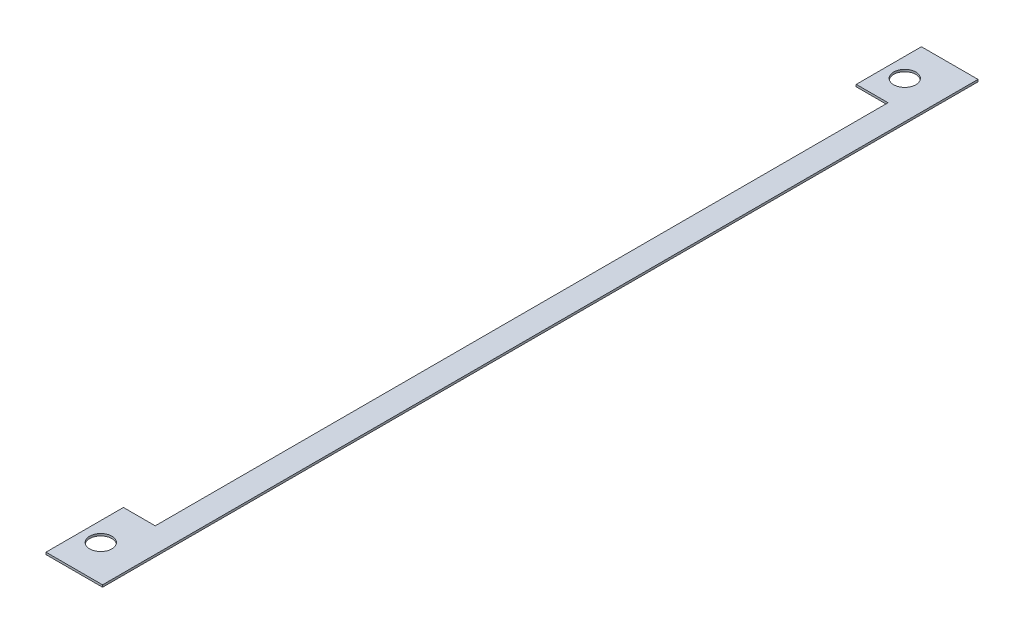
from build123d import *

# Parameters (mm, degrees)
BOSS_EXTRUDE1_DEPTH   = 5.5
BOSS_EXTRUDE1_2_DEPTH = 5.5
SKETCH2_W             = 112.4
SKETCH2_H             = 112.4
BOSS_EXTRUDE2_DEPTH   = 9.4
BOSS_EXTRUDE3_START   = 9.4
SKETCH2_3_W           = 246
SKETCH2_3_H           = 245
BOSS_EXTRUDE3_DEPTH   = 6
SKETCH3_R             = 3.1
CUT_EXTRUDE1_DEPTH    = 251.310147617
BOSS_EXTRUDE4_DEPTH   = 15
SKETCH5_W             = 16
SKETCH5_H             = 22.5
BOSS_EXTRUDE5_DEPTH   = 3.9
SKETCH6_W             = 16
SKETCH6_H             = 20.5
CUT_EXTRUDE2_DEPTH    = 3.4
CHAMFER1_SIZE         = 2
CHAMFER2_SIZE         = 3.05
CHAMFER3_SIZE         = 3
CHAMFER4_SIZE         = 3
SKETCH8_W             = 79.1
SKETCH8_H             = 5
CUT_EXTRUDE3_DEPTH    = 0.1
SKETCH9_W             = 246
SKETCH9_H             = 27.9
CUT_EXTRUDE4_DEPTH    = 324.051327191
CUT_EXTRUDE5_DEPTH    = 250.867004624
SKETCH11_W            = 230.168067581
SKETCH11_H            = 245
CUT_EXTRUDE6_DEPTH    = 250.867004624


with BuildPart() as part:
    # Sketch1 → Boss-Extrude1 (new body)
    with BuildSketch(Plane(origin=(0, 0, 0), x_dir=(1, 0, 0), z_dir=(0, 1, 0))):
        Polygon((-6, -6), (-6, 106.4), (7.7, 106.4), (7.7, 100.4), (0, 100.4), (0, 0), (100.4, 0), (100.4, 40.9), (106.4, 40.9), (106.4, -6), align=None)
    extrude(amount=BOSS_EXTRUDE1_DEPTH)



with BuildPart() as body_2:
    # Sketch1 → Boss-Extrude1 2 (new body)
    with BuildSketch(Plane(origin=(0, 0, 0), x_dir=(1, 0, 0), z_dir=(0, 1, 0))):
        Polygon((92.7, 100.4), (92.7, 106.4), (106.4, 106.4), (106.4, 59.5), (100.4, 59.5), (100.4, 100.4), align=None)
    extrude(amount=BOSS_EXTRUDE1_2_DEPTH)


with BuildPart() as part_1:
    add(part.part)

    add(body_2.part)  # Boss-Extrude2 merges body 2
    # Sketch2 → Boss-Extrude2 (add)
    with BuildSketch(Plane.XZ):
        with Locations((50.2, -50.2)):
            Rectangle(SKETCH2_W, SKETCH2_H)
    extrude(amount=BOSS_EXTRUDE2_DEPTH)

    # Sketch2<3> → Boss-Extrude3 (add)
    with BuildSketch(Plane.XZ.offset(BOSS_EXTRUDE3_START)):
        with Locations((87, -12.9)):
            Rectangle(SKETCH2_3_W, SKETCH2_3_H)
    extrude(amount=BOSS_EXTRUDE3_DEPTH)

    # Sketch3 → Cut-Extrude1 (cut, through all)
    with BuildSketch(Plane(origin=(0, -9.4, 0), x_dir=(1, 0, 0), z_dir=(0, 1, 0))):
        with Locations(Location((-26.5, 125.4, 0), (0, 0, 270))):
            Circle(SKETCH3_R)
        with Locations(Location((-26.5, -99.6, 0), (0, 0, 90))):
            Circle(SKETCH3_R)
        with Locations(Location((199.5, 125.4, 0), (0, 0, 270))):
            Circle(SKETCH3_R)
        with Locations(Location((199.5, -99.6, 0), (0, 0, 270))):
            Circle(SKETCH3_R)
    extrude(amount=-CUT_EXTRUDE1_DEPTH, mode=Mode.SUBTRACT)

    # Sketch4 → Boss-Extrude4 (add)
    with BuildSketch(Plane(origin=(0, -9.4, 0), x_dir=(1, 0, 0), z_dir=(0, 1, 0))):
        with BuildLine():
            Line((-16, -109.6), (49, -109.6))
            Line((49, -109.6), (49, -6))
            Line((49, -6), (-36, -6))
            Line((-36, -6), (-36, -89.6))
            Line((-36, -89.6), (-22, -89.6))
            ThreePointArc((-22, -89.6), (-17.757359313, -91.357359313), (-16, -95.6))
            Line((-16, -95.6), (-16, -109.6))
        make_face()
    extrude(amount=BOSS_EXTRUDE4_DEPTH)

    # Sketch5 → Boss-Extrude5 (add)
    with BuildSketch(Plane(origin=(0, 0, -106.4), x_dir=(-1, 0, 0), z_dir=(0, 0, -1))):
        with Locations((-99.9, 1.85)):
            Rectangle(SKETCH5_W, SKETCH5_H)
        with Locations((-0.5, 1.85)):
            Rectangle(SKETCH5_W, SKETCH5_H)
    extrude(amount=BOSS_EXTRUDE5_DEPTH)

    # Sketch6 → Cut-Extrude2 (cut)
    with BuildSketch(Plane(origin=(0, 0, -110.3), x_dir=(-1, 0, 0), z_dir=(0, 0, -1))):
        with Locations((-0.5, 0.85)):
            Rectangle(SKETCH6_W, SKETCH6_H)
        with Locations((-99.9, 0.85)):
            Rectangle(SKETCH6_W, SKETCH6_H)
    extrude(amount=-CUT_EXTRUDE2_DEPTH, mode=Mode.SUBTRACT)

    # Chamfer1
    # the kernel refuses this chamfer: 2 mm, written as the material it adds along each edge
    with BuildSketch(Plane(origin=(92.7, -5.143365976, -106.4), x_dir=(-0.9996219169112968, 0, -0.027495876610589005), z_dir=(0, 1, 0))) as chamfer1_piece_1_section:
        Polygon((CHAMFER1_SIZE * 0.999621916911, CHAMFER1_SIZE * 0.0274958766106), (-CHAMFER1_SIZE * 0.0274958766106, CHAMFER1_SIZE * 0.999621916911), (0, 0), align=None)
    chamfer1_piece_1 = extrude(amount=10.643365976, mode=Mode.PRIVATE)
    chamfer1_piece_1 = split(chamfer1_piece_1, bisect_by=Plane(origin=(91.9, -2.571682988, -105.57221902), z_dir=(1, 0, 0)), keep=Keep.TOP, mode=Mode.PRIVATE)
    add(chamfer1_piece_1)
    with BuildSketch(Plane(origin=(92.7, 5.5, -106.4), x_dir=(0, 0.9996219169112968, -0.027495876610589075), z_dir=(1, 0, 0)), Plane(origin=(-6, 5.5, -106.4), x_dir=(0, 0.9996219169112968, -0.027495876610589075), z_dir=(1, 0, 0))) as chamfer1_piece_2:
        Polygon((CHAMFER1_SIZE * 0.999621916911, CHAMFER1_SIZE * 0.0274958766106), (-CHAMFER1_SIZE * 0.0274958766106, CHAMFER1_SIZE * 0.999621916911), (0, 0), align=None)
    extrude(amount=13.7)
    with BuildSketch(Plane(origin=(106.4, 5.5, -106.4), x_dir=(-0.027495876610589005, 0, 0.9996219169112968), z_dir=(0, -1, 0))) as chamfer1_piece_3_section:
        Polygon((CHAMFER1_SIZE * 0.999621916911, -CHAMFER1_SIZE * 0.0274958766106), (-CHAMFER1_SIZE * 0.0274958766106, -CHAMFER1_SIZE * 0.999621916911), (0, 0), align=None)
    chamfer1_piece_3 = extrude(amount=14.9, mode=Mode.PRIVATE)
    chamfer1_piece_3 = split(chamfer1_piece_3, bisect_by=Plane(origin=(107.9, -1.95, -105.69608178), z_dir=(-1, 0, 0)), keep=Keep.TOP, mode=Mode.PRIVATE)
    add(chamfer1_piece_3)
    with BuildSketch(Plane(origin=(106.4, 5.5, -106.4), x_dir=(-0.027495876610589005, 0, 0.9996219169112968), z_dir=(0, -1, 0))) as chamfer1_piece_4_section:
        Polygon((CHAMFER1_SIZE * 0.999621916911, -CHAMFER1_SIZE * 0.0274958766106), (-CHAMFER1_SIZE * 0.0274958766106, -CHAMFER1_SIZE * 0.999621916911), (0, 0), align=None)
    chamfer1_piece_4 = extrude(amount=20.043365976, mode=Mode.PRIVATE)
    chamfer1_piece_4 = split(chamfer1_piece_4, bisect_by=Plane(origin=(106.974972825, -9.4, -105.69608178), z_dir=(0, -1, 0)), keep=Keep.TOP, mode=Mode.PRIVATE)
    chamfer1_piece_4 = split(chamfer1_piece_4, bisect_by=Plane(origin=(107.9, -11.971682988, -105.69608178), z_dir=(-1, 0, 0)), keep=Keep.TOP, mode=Mode.PRIVATE)
    add(chamfer1_piece_4)
    with BuildSketch(Plane(origin=(106.4, 5.5, -106.4), x_dir=(-0.027495876610589005, 0, 0.9996219169112968), z_dir=(0, -1, 0))) as chamfer1_piece_5_section:
        Polygon((CHAMFER1_SIZE * 0.999621916911, -CHAMFER1_SIZE * 0.0274958766106), (-CHAMFER1_SIZE * 0.0274958766106, -CHAMFER1_SIZE * 0.999621916911), (0, 0), align=None)
    chamfer1_piece_5 = extrude(amount=20.043365976, mode=Mode.PRIVATE)
    chamfer1_piece_5 = split(chamfer1_piece_5, bisect_by=Plane(origin=(108.09753906, -9.4, -106.284213701), z_dir=(0, -1, 0)), keep=Keep.TOP, mode=Mode.PRIVATE)
    chamfer1_piece_5 = split(chamfer1_piece_5, bisect_by=Plane(origin=(107.9, -11.971682988, -106.284213701), z_dir=(1, 0, 0)), keep=Keep.TOP, mode=Mode.PRIVATE)
    add(chamfer1_piece_5)
    with BuildSketch(Plane(origin=(7.7, -5.143365976, -106.4), x_dir=(0.9996219169112965, 0, -0.027495876610589057), z_dir=(0, 1, 0))) as chamfer1_piece_6_section:
        Polygon((CHAMFER1_SIZE * 0.999621916911, -CHAMFER1_SIZE * 0.0274958766106), (-CHAMFER1_SIZE * 0.0274958766106, -CHAMFER1_SIZE * 0.999621916911), (0, 0), align=None)
    chamfer1_piece_6 = extrude(amount=10.643365976, mode=Mode.PRIVATE)
    chamfer1_piece_6 = split(chamfer1_piece_6, bisect_by=Plane(origin=(8.5, -2.571682988, -105.57221902), z_dir=(-1, 0, 0)), keep=Keep.TOP, mode=Mode.PRIVATE)
    add(chamfer1_piece_6)
    with BuildSketch(Plane(origin=(-6, 5.5, -106.4), x_dir=(-0.9996219169112968, 0, -0.027495876610589075), z_dir=(0, -1, 0))) as chamfer1_piece_7_section:
        Polygon((CHAMFER1_SIZE * 0.999621916911, -CHAMFER1_SIZE * 0.0274958766106), (-CHAMFER1_SIZE * 0.0274958766106, -CHAMFER1_SIZE * 0.999621916911), (0, 0), align=None)
    chamfer1_piece_7 = extrude(amount=14.9, mode=Mode.PRIVATE)
    chamfer1_piece_7 = split(chamfer1_piece_7, bisect_by=Plane(origin=(-7.5, -1.95, -105.69608178), z_dir=(1, 0, 0)), keep=Keep.TOP, mode=Mode.PRIVATE)
    add(chamfer1_piece_7)
    with BuildSketch(Plane(origin=(-6, 5.5, -106.4), x_dir=(-0.9996219169112968, 0, -0.027495876610589075), z_dir=(0, -1, 0))) as chamfer1_piece_8_section:
        Polygon((CHAMFER1_SIZE * 0.999621916911, -CHAMFER1_SIZE * 0.0274958766106), (-CHAMFER1_SIZE * 0.0274958766106, -CHAMFER1_SIZE * 0.999621916911), (0, 0), align=None)
    chamfer1_piece_8 = extrude(amount=20.043365976, mode=Mode.PRIVATE)
    chamfer1_piece_8 = split(chamfer1_piece_8, bisect_by=Plane(origin=(-7.69753906, -9.4, -106.284213701), z_dir=(0, -1, 0)), keep=Keep.TOP, mode=Mode.PRIVATE)
    chamfer1_piece_8 = split(chamfer1_piece_8, bisect_by=Plane(origin=(-7.5, -11.971682988, -106.284213701), z_dir=(-1, 0, 0)), keep=Keep.TOP, mode=Mode.PRIVATE)
    add(chamfer1_piece_8)
    with BuildSketch(Plane(origin=(-6, 5.5, -106.4), x_dir=(-0.9996219169112968, 0, -0.027495876610589075), z_dir=(0, -1, 0))) as chamfer1_piece_9_section:
        Polygon((CHAMFER1_SIZE * 0.999621916911, -CHAMFER1_SIZE * 0.0274958766106), (-CHAMFER1_SIZE * 0.0274958766106, -CHAMFER1_SIZE * 0.999621916911), (0, 0), align=None)
    chamfer1_piece_9 = extrude(amount=20.043365976, mode=Mode.PRIVATE)
    chamfer1_piece_9 = split(chamfer1_piece_9, bisect_by=Plane(origin=(-6.574972825, -9.4, -105.69608178), z_dir=(0, -1, 0)), keep=Keep.TOP, mode=Mode.PRIVATE)
    chamfer1_piece_9 = split(chamfer1_piece_9, bisect_by=Plane(origin=(-7.5, -11.971682988, -105.69608178), z_dir=(1, 0, 0)), keep=Keep.TOP, mode=Mode.PRIVATE)
    add(chamfer1_piece_9)
    with BuildSketch(Plane(origin=(87.556634024, 5.5, -106.4), x_dir=(0, 0.9996219169112968, -0.027495876610589075), z_dir=(1, 0, 0))) as chamfer1_piece_10a_section:
        Polygon((CHAMFER1_SIZE * 0.999621916911, CHAMFER1_SIZE * 0.0274958766106), (-CHAMFER1_SIZE * 0.0274958766106, CHAMFER1_SIZE * 0.999621916911), (0, 0), align=None)
    chamfer1_piece_10a = extrude(amount=18.843365976, mode=Mode.PRIVATE)
    chamfer1_piece_10a = split(chamfer1_piece_10a, bisect_by=Plane(origin=(91.9, 6.159587254, -105.740412746), z_dir=(1, 0, 0)), keep=Keep.TOP, mode=Mode.PRIVATE)
    chamfer1_piece_10a = split(chamfer1_piece_10a, bisect_by=Plane(origin=(92.7, 6.159587254, -105.740412746), z_dir=(-1, 0, 0)), keep=Keep.TOP, mode=Mode.PRIVATE)
    with BuildSketch(Plane(origin=(92.7, 0, -106.4), x_dir=(-0.9996219169112968, 0, -0.027495876610589005), z_dir=(0, 1, 0))) as chamfer1_piece_10b_section:
        Polygon((CHAMFER1_SIZE * 0.999621916911, CHAMFER1_SIZE * 0.0274958766106), (-CHAMFER1_SIZE * 0.0274958766106, CHAMFER1_SIZE * 0.999621916911), (0, 0), align=None)
    chamfer1_piece_10b = extrude(amount=10.643365976, mode=Mode.PRIVATE)
    chamfer1_piece_10b = split(chamfer1_piece_10b, bisect_by=Plane(origin=(91.9, 8.071682988, -105.57221902), z_dir=(1, 0, 0)), keep=Keep.TOP, mode=Mode.PRIVATE)
    chamfer1_piece_10b = split(chamfer1_piece_10b, bisect_by=Plane(origin=(92.36112716, 5.5, -105.57221902), z_dir=(0, 1, 0)), keep=Keep.TOP, mode=Mode.PRIVATE)
    chamfer1_piece_10 = chamfer1_piece_10a & chamfer1_piece_10b
    add(chamfer1_piece_10)
    with BuildSketch(Plane(origin=(106.4, 10.643365976, -106.4), x_dir=(-0.027495876610589005, 0, 0.9996219169112968), z_dir=(0, -1, 0))) as chamfer1_piece_11a_section:
        Polygon((CHAMFER1_SIZE * 0.999621916911, -CHAMFER1_SIZE * 0.0274958766106), (-CHAMFER1_SIZE * 0.0274958766106, -CHAMFER1_SIZE * 0.999621916911), (0, 0), align=None)
    chamfer1_piece_11a = extrude(amount=20.043365976, mode=Mode.PRIVATE)
    chamfer1_piece_11a = split(chamfer1_piece_11a, bisect_by=Plane(origin=(106.974972825, 5.5, -105.69608178), z_dir=(0, 1, 0)), keep=Keep.TOP, mode=Mode.PRIVATE)
    chamfer1_piece_11a = split(chamfer1_piece_11a, bisect_by=Plane(origin=(107.9, 8.071682988, -105.69608178), z_dir=(-1, 0, 0)), keep=Keep.TOP, mode=Mode.PRIVATE)
    with BuildSketch(Plane(origin=(92.7, 5.5, -106.4), x_dir=(0, 0.9996219169112968, -0.027495876610589075), z_dir=(1, 0, 0))) as chamfer1_piece_11b_section:
        Polygon((CHAMFER1_SIZE * 0.999621916911, CHAMFER1_SIZE * 0.0274958766106), (-CHAMFER1_SIZE * 0.0274958766106, CHAMFER1_SIZE * 0.999621916911), (0, 0), align=None)
    chamfer1_piece_11b = extrude(amount=18.843365976, mode=Mode.PRIVATE)
    chamfer1_piece_11b = split(chamfer1_piece_11b, bisect_by=Plane(origin=(106.4, 6.159587254, -105.740412746), z_dir=(1, 0, 0)), keep=Keep.TOP, mode=Mode.PRIVATE)
    chamfer1_piece_11b = split(chamfer1_piece_11b, bisect_by=Plane(origin=(107.9, 6.159587254, -105.740412746), z_dir=(-1, 0, 0)), keep=Keep.TOP, mode=Mode.PRIVATE)
    chamfer1_piece_11 = chamfer1_piece_11a & chamfer1_piece_11b
    add(chamfer1_piece_11)
    with BuildSketch(Plane(origin=(-6, 5.5, -106.4), x_dir=(0, 0.9996219169112968, -0.027495876610589075), z_dir=(1, 0, 0))) as chamfer1_piece_12a_section:
        Polygon((CHAMFER1_SIZE * 0.999621916911, CHAMFER1_SIZE * 0.0274958766106), (-CHAMFER1_SIZE * 0.0274958766106, CHAMFER1_SIZE * 0.999621916911), (0, 0), align=None)
    chamfer1_piece_12a = extrude(amount=18.843365976, mode=Mode.PRIVATE)
    chamfer1_piece_12a = split(chamfer1_piece_12a, bisect_by=Plane(origin=(8.5, 6.159587254, -105.740412746), z_dir=(-1, 0, 0)), keep=Keep.TOP, mode=Mode.PRIVATE)
    chamfer1_piece_12a = split(chamfer1_piece_12a, bisect_by=Plane(origin=(7.7, 6.159587254, -105.740412746), z_dir=(1, 0, 0)), keep=Keep.TOP, mode=Mode.PRIVATE)
    with BuildSketch(Plane(origin=(7.7, 0, -106.4), x_dir=(0.9996219169112965, 0, -0.027495876610589057), z_dir=(0, 1, 0))) as chamfer1_piece_12b_section:
        Polygon((CHAMFER1_SIZE * 0.999621916911, -CHAMFER1_SIZE * 0.0274958766106), (-CHAMFER1_SIZE * 0.0274958766106, -CHAMFER1_SIZE * 0.999621916911), (0, 0), align=None)
    chamfer1_piece_12b = extrude(amount=10.643365976, mode=Mode.PRIVATE)
    chamfer1_piece_12b = split(chamfer1_piece_12b, bisect_by=Plane(origin=(8.5, 8.071682988, -105.57221902), z_dir=(-1, 0, 0)), keep=Keep.TOP, mode=Mode.PRIVATE)
    chamfer1_piece_12b = split(chamfer1_piece_12b, bisect_by=Plane(origin=(8.03887284, 5.5, -105.57221902), z_dir=(0, 1, 0)), keep=Keep.TOP, mode=Mode.PRIVATE)
    chamfer1_piece_12 = chamfer1_piece_12a & chamfer1_piece_12b
    add(chamfer1_piece_12)
    with BuildSketch(Plane(origin=(-6, 10.643365976, -106.4), x_dir=(-0.9996219169112968, 0, -0.027495876610589075), z_dir=(0, -1, 0))) as chamfer1_piece_13a_section:
        Polygon((CHAMFER1_SIZE * 0.999621916911, -CHAMFER1_SIZE * 0.0274958766106), (-CHAMFER1_SIZE * 0.0274958766106, -CHAMFER1_SIZE * 0.999621916911), (0, 0), align=None)
    chamfer1_piece_13a = extrude(amount=20.043365976, mode=Mode.PRIVATE)
    chamfer1_piece_13a = split(chamfer1_piece_13a, bisect_by=Plane(origin=(-7.5, 8.071682988, -105.69608178), z_dir=(1, 0, 0)), keep=Keep.TOP, mode=Mode.PRIVATE)
    chamfer1_piece_13a = split(chamfer1_piece_13a, bisect_by=Plane(origin=(-6.574972825, 5.5, -105.69608178), z_dir=(0, 1, 0)), keep=Keep.TOP, mode=Mode.PRIVATE)
    with BuildSketch(Plane(origin=(-11.143365976, 5.5, -106.4), x_dir=(0, 0.9996219169112968, -0.027495876610589075), z_dir=(1, 0, 0))) as chamfer1_piece_13b_section:
        Polygon((CHAMFER1_SIZE * 0.999621916911, CHAMFER1_SIZE * 0.0274958766106), (-CHAMFER1_SIZE * 0.0274958766106, CHAMFER1_SIZE * 0.999621916911), (0, 0), align=None)
    chamfer1_piece_13b = extrude(amount=18.843365976, mode=Mode.PRIVATE)
    chamfer1_piece_13b = split(chamfer1_piece_13b, bisect_by=Plane(origin=(-7.5, 6.159587254, -105.740412746), z_dir=(1, 0, 0)), keep=Keep.TOP, mode=Mode.PRIVATE)
    chamfer1_piece_13b = split(chamfer1_piece_13b, bisect_by=Plane(origin=(-6, 6.159587254, -105.740412746), z_dir=(-1, 0, 0)), keep=Keep.TOP, mode=Mode.PRIVATE)
    chamfer1_piece_13 = chamfer1_piece_13a & chamfer1_piece_13b
    add(chamfer1_piece_13)
    # the kernel refuses this chamfer: 2 mm, written as the material it takes off along each edge
    with BuildSketch(Plane(origin=(113.043365976, 13.1, -106.4), x_dir=(1.4427442484973125e-15, -0.9996219169112968, 0.027495876610589075), z_dir=(-1, 0, 0)), Plane(origin=(-12.643365976, 13.1, -106.4), x_dir=(0, 0.027495876610586414, -0.9996219169112968), z_dir=(1, 0, 0))) as chamfer1_2_piece_1:
        Polygon((CHAMFER1_SIZE * 0.999621916911, -CHAMFER1_SIZE * 0.0274958766106), (-CHAMFER1_SIZE * 0.0274958766106, -CHAMFER1_SIZE * 0.999621916911), (0, 0), align=None)
    extrude(amount=26.286731952, mode=Mode.SUBTRACT)

    # Chamfer2
    chamfer2_edges = [part_1.edges().sort_by_distance(p)[0] for p in [
        (199.5, -9.4, -128.5),
        (-26.5, -9.4, -128.5),
        (-26.5, -9.4, 102.7),
        (199.5, -9.4, 96.5),
    ]]
    chamfer(chamfer2_edges, length=CHAMFER2_SIZE)

    # Chamfer3
    chamfer3_edges = [part_1.edges().sort_by_distance(p)[0] for p in [
        (106.4, 5.5, -17.45),
    ]]
    chamfer(chamfer3_edges, length=CHAMFER3_SIZE)
    chamfer3_2_edges = [part_1.edges().sort_by_distance(p)[0] for p in [
        (106.4, 5.5, -81.95),
    ]]
    chamfer(chamfer3_2_edges, length=CHAMFER3_SIZE)
    chamfer3_3_edges = [part_1.edges().sort_by_distance(p)[0] for p in [
        (76.2, 5.5, 6),
    ]]
    chamfer(chamfer3_3_edges, length=CHAMFER3_SIZE)
    chamfer3_4_edges = [part_1.edges().sort_by_distance(p)[0] for p in [
        (49, 5.6, 57.8),
    ]]
    chamfer(chamfer3_4_edges, length=CHAMFER3_SIZE)
    chamfer3_5_edges = [part_1.edges().sort_by_distance(p)[0] for p in [
        (15, 5.6, 109.6),
    ]]
    chamfer(chamfer3_5_edges, length=CHAMFER3_SIZE)
    chamfer3_6_edges = [part_1.edges().sort_by_distance(p)[0] for p in [
        (-36, 5.6, 47.8),
    ]]
    chamfer(chamfer3_6_edges, length=CHAMFER3_SIZE)
    chamfer3_7_edges = [part_1.edges().sort_by_distance(p)[0] for p in [
        (-6, 5.5, -49.2),
    ]]
    chamfer(chamfer3_7_edges, length=CHAMFER3_SIZE)
    chamfer3_8_edges = [part_1.edges().sort_by_distance(p)[0] for p in [
        (-16, 5.6, 101.1),
        (-27.5, 5.6, 89.6),
        (-17.757359313, 5.6, 91.357359313),
    ]]
    chamfer(chamfer3_8_edges, length=CHAMFER3_SIZE)

    # Chamfer4
    chamfer4_edges = [part_1.edges().sort_by_distance(p)[0] for p in [
        (-36, -9.4, -64.7),
        (129.5, -9.4, 109.6),
        (-36, -3.4, 89.6),
        (-36, -3.4, 6),
        (-16, -3.4, 109.6),
        (49, -3.4, 109.6),
        (-36, -9.4, 99.6),
        (87, -9.4, -135.4),
        (-26, -9.4, 109.6),
        (210, -9.4, -12.9),
    ]]
    chamfer(chamfer4_edges, length=CHAMFER4_SIZE)

    # Sketch8 → Cut-Extrude3 (cut)
    with BuildSketch(Plane(origin=(0, 5.6, 0), x_dir=(1, 0, 0), z_dir=(0, 1, 0))):
        with Locations((6.55, -8.5)):
            Rectangle(SKETCH8_W, SKETCH8_H)
    extrude(amount=-CUT_EXTRUDE3_DEPTH, mode=Mode.SUBTRACT)

    # Chamfer5
    # the kernel refuses this chamfer: 3 mm, written as the material it takes off along each edge
    with BuildSketch(Plane(origin=(6.229157809, 5.5, 6), x_dir=(0, -0.9850292351397439, -0.17238737169529297), z_dir=(-1, 0, 0))) as chamfer5_piece_1_section:
        with BuildLine():
            Line((3.691663124, 0), (-1.253737533, 3.472249821))
            Line((-1.253737533, 3.472249821), (-1.697000689, 3.394675503))
            ThreePointArc((-1.697000689, 3.394675503), (-0.756697539, 1.713403919), (-0.443263156, -0.077574317))
            Line((-0.443263156, -0.077574317), (0.077574317, -0.443263156))
            ThreePointArc((0.077574317, -0.443263156), (1.868552553, -0.129828772), (3.769237441, -0.443263156))
            Line((3.769237441, -0.443263156), (3.691663124, 0))
        make_face()
    chamfer5_piece_1 = extrude(amount=39.229157809, mode=Mode.PRIVATE)
    chamfer5_piece_1 = split(chamfer5_piece_1, bisect_by=Plane(origin=(-4.039459416, 4.460540584, 7.280331392), z_dir=(-0.7071067811865476, 0.7071067811865476, 0)), keep=Keep.TOP, mode=Mode.PRIVATE)
    chamfer5_piece_1 = split(chamfer5_piece_1, bisect_by=Plane(origin=(-6, 5.114054112, 7.280331392), z_dir=(1, 0, 0)), keep=Keep.TOP, mode=Mode.PRIVATE)
    add(chamfer5_piece_1, mode=Mode.SUBTRACT)
    with BuildSketch(Plane(origin=(6.229157809, 5.5, 6), x_dir=(0, -0.9850292351397439, -0.17238737169529297), z_dir=(-1, 0, 0))) as chamfer5_piece_2_section:
        with BuildLine():
            Line((3.691663124, 0), (-1.253737533, 3.472249821))
            Line((-1.253737533, 3.472249821), (-1.697000689, 3.394675503))
            ThreePointArc((-1.697000689, 3.394675503), (-0.756697539, 1.713403919), (-0.443263156, -0.077574317))
            Line((-0.443263156, -0.077574317), (0.077574317, -0.443263156))
            ThreePointArc((0.077574317, -0.443263156), (1.868552553, -0.129828772), (3.769237441, -0.443263156))
            Line((3.769237441, -0.443263156), (3.691663124, 0))
        make_face()
    chamfer5_piece_2 = extrude(amount=39.229157809, mode=Mode.PRIVATE)
    chamfer5_piece_2 = split(chamfer5_piece_2, bisect_by=Plane(origin=(-6.302738925, 2.197261075, 5.315019574), z_dir=(0.7071067811865476, -0.7071067811865476, 0)), keep=Keep.TOP, mode=Mode.PRIVATE)
    chamfer5_piece_2 = split(chamfer5_piece_2, bisect_by=Plane(origin=(-6, 2.0963481, 5.315019574), z_dir=(-1, 0, 0)), keep=Keep.TOP, mode=Mode.PRIVATE)
    add(chamfer5_piece_2, mode=Mode.SUBTRACT)
    with BuildSketch(Plane(origin=(6.229157809, 5.5, 6), x_dir=(0, -0.9850292351397439, -0.17238737169529297), z_dir=(-1, 0, 0))) as chamfer5_piece_3_section:
        with BuildLine():
            Line((3.691663124, 0), (-1.253737533, 3.472249821))
            Line((-1.253737533, 3.472249821), (-1.697000689, 3.394675503))
            ThreePointArc((-1.697000689, 3.394675503), (-0.756697539, 1.713403919), (-0.443263156, -0.077574317))
            Line((-0.443263156, -0.077574317), (0.077574317, -0.443263156))
            ThreePointArc((0.077574317, -0.443263156), (1.868552553, -0.129828772), (3.769237441, -0.443263156))
            Line((3.769237441, -0.443263156), (3.691663124, 0))
        make_face()
    chamfer5_piece_3 = extrude(amount=39.229157809, mode=Mode.PRIVATE)
    chamfer5_piece_3 = split(chamfer5_piece_3, bisect_by=Plane(origin=(-11.711520685, -3.211520685, 6.918404597), z_dir=(-0.7071067811865476, 0.7071067811865476, 0)), keep=Keep.TOP, mode=Mode.PRIVATE)
    chamfer5_piece_3 = split(chamfer5_piece_3, bisect_by=Plane(origin=(-6, 4.583653926, 6.918404597), z_dir=(-1, 0, 0)), keep=Keep.TOP, mode=Mode.PRIVATE)
    add(chamfer5_piece_3, mode=Mode.SUBTRACT)
    with BuildSketch(Plane(origin=(6.229157809, 5.5, 6), x_dir=(0, -0.9850292351397439, -0.17238737169529297), z_dir=(-1, 0, 0))) as chamfer5_piece_4_section:
        with BuildLine():
            Line((3.691663124, 0), (-1.253737533, 3.472249821))
            Line((-1.253737533, 3.472249821), (-1.697000689, 3.394675503))
            ThreePointArc((-1.697000689, 3.394675503), (-0.756697539, 1.713403919), (-0.443263156, -0.077574317))
            Line((-0.443263156, -0.077574317), (0.077574317, -0.443263156))
            ThreePointArc((0.077574317, -0.443263156), (1.868552553, -0.129828772), (3.769237441, -0.443263156))
            Line((3.769237441, -0.443263156), (3.691663124, 0))
        make_face()
    chamfer5_piece_4 = extrude(amount=48.458315618, mode=Mode.PRIVATE)
    chamfer5_piece_4 = split(chamfer5_piece_4, bisect_by=Plane(origin=(-33, 4.582402261, 6.917597739), z_dir=(-1, 0, 0)), keep=Keep.TOP, mode=Mode.PRIVATE)
    add(chamfer5_piece_4, mode=Mode.SUBTRACT)

    # Sketch9 → Cut-Extrude4 (cut, through all)
    with BuildSketch(Plane.XY.offset(109.6)):
        with Locations((87, -0.85)):
            Rectangle(SKETCH9_W, SKETCH9_H)
    extrude(amount=-CUT_EXTRUDE4_DEPTH, mode=Mode.SUBTRACT)

    # Sketch10 → Cut-Extrude5 (cut, through all)
    with BuildSketch(Plane(origin=(0, -14.8, 0), x_dir=(1, 0, 0), z_dir=(0, 1, 0))):
        Polygon((-13.320267735, 126.74467243), (187.662657728, 126.74467243), (187.662657728, 117.157752647), (203.07020738, 117.157752647), (203.07020738, -87.933852724), (190.401777666, -87.933852724), (190.401777666, -102.656622391), (-18.113727627, -102.656622391), (-18.113727627, -87.933852724), (-30.439767349, -87.933852724), (-30.439767349, 117.157752647), (-18.113727627, 117.157752647), (-18.113727627, 126.74467243), align=None)
    extrude(amount=-CUT_EXTRUDE5_DEPTH, mode=Mode.SUBTRACT)

    # Sketch11 → Cut-Extrude6 (cut, through all)
    with BuildSketch(Plane(origin=(0, -14.8, 0), x_dir=(1, 0, 0), z_dir=(0, 1, 0))):
        with Locations((79.084033791, 12.9)):
            Rectangle(SKETCH11_W, SKETCH11_H)
    extrude(amount=-CUT_EXTRUDE6_DEPTH, mode=Mode.SUBTRACT)


solid = part_1.part
